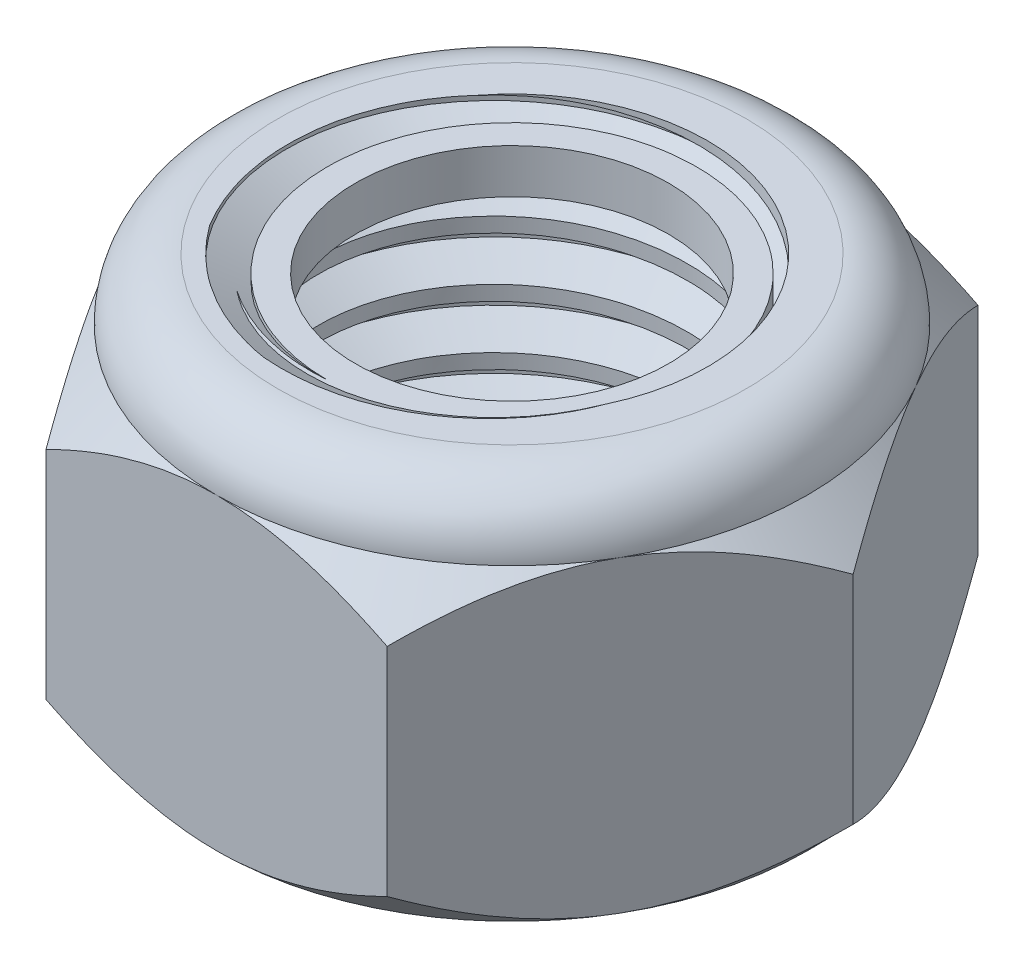
from build123d import *

# Parameters (mm, degrees)
BOSS_EXTRUDE1_DEPTH     = 2.085
SKETCH2_OUTSIDE_W       = 30.616
SKETCH2_OUTSIDE_H       = 29.378
SKETCH2_OUTSIDE_R       = 4
CUT_EXTRUDE1_DEPTH      = 8.397447758
CUT_EXTRUDE1_DRAFT      = -45
MIRROR1_COPY_1_SKETCH_W = 30.616
MIRROR1_COPY_1_SKETCH_H = 29.378
MIRROR1_COPY_1_SKETCH_R = 4
MIRROR1_COPY_1_DEPTH    = 8.397447758
MIRROR1_COPY_1_DRAFT    = -45
THREAD1_PITCH           = 0.8


with BuildPart() as part:
    # Sketch1 → Boss-Extrude1 (new, symmetric)
    with BuildSketch(Plane(origin=(0, 0, 0), x_dir=(1, 0, 0), z_dir=(0, 1, 0))):
        Polygon((2.309401077, -4), (4.618802154, 0), (2.309401077, 4), (-2.309401077, 4), (-4.618802154, 0), (-2.309401077, -4), align=None)
    extrude(amount=BOSS_EXTRUDE1_DEPTH, both=True)


with BuildPart() as cut_extrude1_tool:
    # Sketch2 outside → Cut-Extrude1 (with draft: the straight prism first)
    with BuildSketch(Plane(origin=(0, 2.085, 0), x_dir=(1, 0, 0), z_dir=(0, 1, 0))):
        Rectangle(SKETCH2_OUTSIDE_W, SKETCH2_OUTSIDE_H)
        Circle(SKETCH2_OUTSIDE_R, mode=Mode.SUBTRACT)
    extrude(amount=-CUT_EXTRUDE1_DEPTH)
    # Cut-Extrude1: the draft: its side faces are tilted about the plane it starts from
    cut_extrude1_sides = [cut_extrude1_tool.faces().sort_by_distance(p)[0] for p in [
        (0, -2.113723879, 14.689),
        (15.308, -2.113723879, 0),
        (0, -2.113723879, -14.689),
        (-15.308, -2.113723879, 0),
        (-4, -2.113723879, 0),
    ]]
    draft(cut_extrude1_sides, Plane(origin=(0, 2.085, 0), x_dir=(1, 0, 0), z_dir=(0, 1, 0)), CUT_EXTRUDE1_DRAFT)


with BuildPart() as part_1:
    add(part.part)

    # Cut-Extrude1: cut by cut_extrude1_tool
    add(cut_extrude1_tool.part, mode=Mode.SUBTRACT)


with BuildPart() as mirror1_copy_1_tool:
    # Mirror1 copy 1 sketch → Mirror1 copy 1 (with draft: the straight prism first)
    with BuildSketch(Plane.XZ.offset(2.085)):
        Rectangle(MIRROR1_COPY_1_SKETCH_W, MIRROR1_COPY_1_SKETCH_H)
        Circle(MIRROR1_COPY_1_SKETCH_R, mode=Mode.SUBTRACT)
    extrude(amount=-MIRROR1_COPY_1_DEPTH)
    # Mirror1 copy 1: the draft: its side faces are tilted about the plane it starts from
    mirror1_copy_1_sides = [mirror1_copy_1_tool.faces().sort_by_distance(p)[0] for p in [
        (0, 2.113723879, 14.689),
        (15.308, 2.113723879, 0),
        (0, 2.113723879, -14.689),
        (-15.308, 2.113723879, 0),
        (-4, 2.113723879, 0),
    ]]
    draft(mirror1_copy_1_sides, Plane.XZ.offset(2.085), MIRROR1_COPY_1_DRAFT)


with BuildPart() as part_2:
    add(part_1.part)

    # Mirror1 copy 1: cut by mirror1_copy_1_tool
    add(mirror1_copy_1_tool.part, mode=Mode.SUBTRACT)

    # Sketch3 → Revolve1 (revolve)
    with BuildSketch(Plane(origin=(0, 0, 0), x_dir=(0, 0, -1), z_dir=(1, 0, 0)), mode=Mode.PRIVATE) as revolve1_sk:
        with BuildLine():
            Line((0, 2.085), (0, 2.915))
            Line((0, 2.915), (-3.17, 2.915))
            ThreePointArc((-3.17, 2.915), (-3.756898628, 2.671898628), (-4, 2.085))
            Line((-4, 2.085), (0, 2.085))
        make_face()
    revolve(revolve1_sk.sketch.rotate(Axis((0, 2.085, 0), (0, 1, 0)), 180), axis=Axis((0, 2.085, 0), (0, 1, 0)))

    # Sketch4 → Cut-Revolve1 (revolve, cut)
    with BuildSketch(Plane(origin=(0, 0, 0), x_dir=(0, 0, -1), z_dir=(1, 0, 0))):
        Polygon((0, 0), (0, 2.915), (2.65, 2.915), (2.65, 2.685), (2.12, 2.685), (2.12, 2.085), (2.5, 2.085), (2.5, -2.085), (0, -2.085), align=None)
    revolve(axis=Axis((0, 0, 0), (0, 1, 0)), mode=Mode.SUBTRACT)

    # Thread1: the profile of Thread Profile3 profile screwed along a right-hand helix of 12.5 turns, 8 arcs to a turn; built about Z, then put on its axis
    thread1_z = Axis((0, 0, 0), (0, 0, 1))
    thread1_corners = [(2.4997, 0, -0.000173205), (2.9330127, 0, 0.249999999), (2.9330127, 0, 0.349999999), (2.4997, 0, 0.600173203)]
    with BuildLine(mode=Mode.PRIVATE) as thread1_profile:
        Line(thread1_corners[0], thread1_corners[1])
        Line(thread1_corners[1], thread1_corners[2])
        Line(thread1_corners[2], thread1_corners[3])
        Line(thread1_corners[3], thread1_corners[0])
    thread1_cap = Face(thread1_profile.wire())
    thread1_turn_angles = [0, 22.5, 45, 67.5, 90, 112.5, 135, 157.5, 180, 202.5, 225, 247.5, 270, 292.5, 315, 337.5, 360]
    thread1_turn_weights = [1, 0.9238795325112867, 1, 0.9238795325112867, 1, 0.9238795325112867, 1, 0.9238795325112867, 1, 0.9238795325112867, 1, 0.9238795325112867, 1, 0.9238795325112867, 1, 0.9238795325112867, 1]
    thread1_turn_rails = [Edge.make_bspline([Vector(p[0], p[1], 0).rotate(thread1_z, thread1_turn_angles[k]) / thread1_turn_weights[k] + Vector(0, 0, p[2] + THREAD1_PITCH * thread1_turn_angles[k] / 360) for k in range(17)], [0, 0, 0, 1, 1, 2, 2, 3, 3, 4, 4, 5, 5, 6, 6, 7, 7, 8, 8, 8], 2, thread1_turn_weights) for p in thread1_corners]
    thread1_turn_sides = [Face.make_surface_from_curves(thread1_turn_rails[p[0]], thread1_turn_rails[p[1]]) for p in [(0, 1), (1, 2), (2, 3), (3, 0)]]
    thread1_last_angles = [4320, 4342.5, 4365, 4387.5, 4410, 4432.5, 4455, 4477.5, 4500]
    thread1_last_weights = [1, 0.9238795325112867, 1, 0.9238795325112867, 1, 0.9238795325112867, 1, 0.9238795325112867, 1]
    thread1_last_rails = [Edge.make_bspline([Vector(p[0], p[1], 0).rotate(thread1_z, thread1_last_angles[k]) / thread1_last_weights[k] + Vector(0, 0, p[2] + THREAD1_PITCH * thread1_last_angles[k] / 360) for k in range(9)], [0, 0, 0, 1, 1, 2, 2, 3, 3, 4, 4, 4], 2, thread1_last_weights) for p in thread1_corners]
    thread1_last_sides = [Face.make_surface_from_curves(thread1_last_rails[p[0]], thread1_last_rails[p[1]]) for p in [(0, 1), (1, 2), (2, 3), (3, 0)]]
    thread1 = Plane(origin=(0, 7.085, 0), x_dir=(-1, 0, 0), z_dir=(0, -1, 0)) * Solid(Shell([*[p.moved(Location((0, 0, THREAD1_PITCH * i))) for i in range(12) for p in thread1_turn_sides], *thread1_last_sides, thread1_cap, thread1_cap.rotate(thread1_z, 4500).moved(Location((0, 0, THREAD1_PITCH * 4500 / 360)))]))
    add(thread1, mode=Mode.SUBTRACT)


solid = part_2.part
